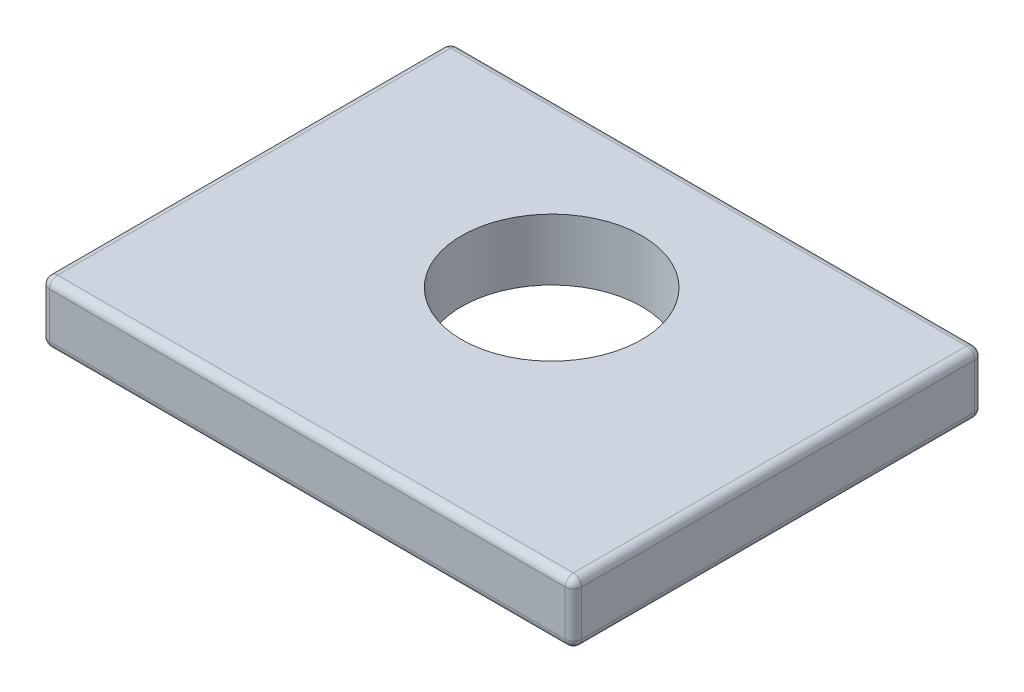
from build123d import *

# Parameters (mm, degrees)
SKETCH1_W           = 6.5
SKETCH1_H           = 5
BOSS_EXTRUDE1_DEPTH = 0.75
SKETCH2_R           = 1.1
CUT_EXTRUDE1_DEPTH  = 5.168333
FILLET1_R           = 0.1


with BuildPart() as part:
    # Sketch1 → Boss-Extrude1 (new body)
    with BuildSketch(Plane(origin=(0, 0, 0), x_dir=(1, 0, 0), z_dir=(0, 1, 0))):
        Rectangle(SKETCH1_W, SKETCH1_H)
    extrude(amount=BOSS_EXTRUDE1_DEPTH)

    # Sketch2 → Cut-Extrude1 (cut, through all)
    with BuildSketch(Plane(origin=(0, 0, 0), x_dir=(1, 0, 0), z_dir=(0, 1, 0))):
        with Locations((0, 0.484711092)):
            Circle(SKETCH2_R)
    extrude(amount=CUT_EXTRUDE1_DEPTH, mode=Mode.SUBTRACT)

    # Fillet1
    fillet1_edges = [part.edges().sort_by_distance(p)[0] for p in [
        (3.25, 0.75, 0),
        (3.25, 0, 0),
        (0, 0.75, 2.5),
        (3.25, 0.375, 2.5),
        (0, 0, 2.5),
        (-3.25, 0.75, 0),
        (-3.25, 0.375, 2.5),
        (-3.25, 0, 0),
        (3.25, 0.375, -2.5),
        (0, 0.75, -2.5),
        (-3.25, 0.375, -2.5),
        (0, 0, -2.5),
    ]]
    fillet(fillet1_edges, radius=FILLET1_R)


solid = part.part
